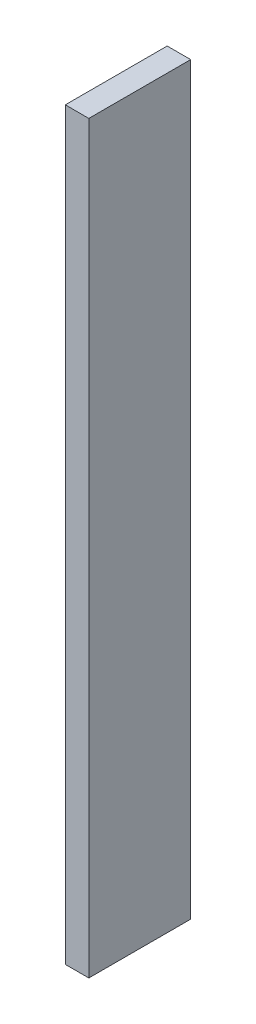
from build123d import *

# Parameters (mm, degrees)
SKETCH1_W           = 152.4
SKETCH1_H           = 660.4
BOSS_EXTRUDE1_DEPTH = 4826


with BuildPart() as part:
    # Sketch1 → Boss-Extrude1 (new body)
    with BuildSketch(Plane(origin=(0, 0, 0), x_dir=(1, 0, 0), z_dir=(0, 1, 0))):
        Rectangle(SKETCH1_W, SKETCH1_H)
    extrude(amount=BOSS_EXTRUDE1_DEPTH)


solid = part.part
